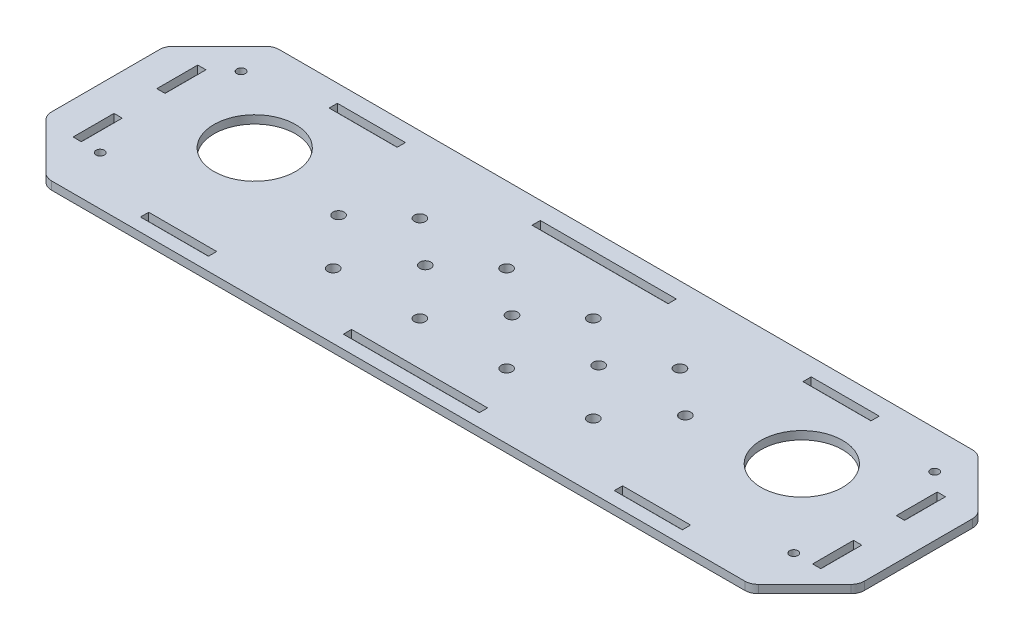
from build123d import *

# Parameters (mm, degrees)
BASE_FLANGE1_START = -3
BASE_FLANGE1_DEPTH = 3
SKETCH6_R          = 1.55
CUT_EXTRUDE1_DEPTH = 10
SKETCH7_R          = 1.55
CUT_EXTRUDE2_DEPTH = 10
SKETCH8_W          = 50.2
SKETCH8_H          = 3.05
SKETCH8_W_2        = 25.1
SKETCH8_W_3        = 3.05
SKETCH8_H_2        = 15.1
CUT_EXTRUDE5_DEPTH = 10
SKETCH12_R         = 15.05
SKETCH12_R_2       = 2.05
CUT_EXTRUDE6_DEPTH = 10


# Read off the part's stored shape, not the designer's step: Base-Flange1
with BuildPart() as part:
    # Base-Flange1 outline → Base-Flange1 (new body)
    with BuildSketch(Plane(origin=(0, 0, 0), x_dir=(1, 0, 0), z_dir=(0, 1, 0)).offset(BASE_FLANGE1_START)):
        with BuildLine():
            Line((-127.928932188, 76), (127.928932188, 76))
            ThreePointArc((127.928932188, 76), (129.84234935, 76.380602337), (131.464466094, 77.464466094))
            Line((131.464466094, 77.464466094), (148.535533906, 94.535533906))
            ThreePointArc((148.535533906, 94.535533906), (149.619397663, 96.15765065), (150, 98.071067812))
            Line((150, 98.071067812), (150, 137.928932188))
            ThreePointArc((150, 137.928932188), (149.619397663, 139.84234935), (148.535533906, 141.464466094))
            Line((148.535533906, 141.464466094), (131.464466094, 158.535533906))
            ThreePointArc((131.464466094, 158.535533906), (129.84234935, 159.619397663), (127.928932188, 160))
            Line((127.928932188, 160), (-127.928932188, 160))
            ThreePointArc((-127.928932188, 160), (-129.84234935, 159.619397663), (-131.464466094, 158.535533906))
            Line((-131.464466094, 158.535533906), (-148.535533906, 141.464466094))
            ThreePointArc((-148.535533906, 141.464466094), (-149.619397663, 139.84234935), (-150, 137.928932188))
            Line((-150, 137.928932188), (-150, 98.071067812))
            ThreePointArc((-150, 98.071067812), (-149.619397663, 96.15765065), (-148.535533906, 94.535533906))
            Line((-148.535533906, 94.535533906), (-131.464466094, 77.464466094))
            ThreePointArc((-131.464466094, 77.464466094), (-129.84234935, 76.380602337), (-127.928932188, 76))
        make_face()
    extrude(amount=BASE_FLANGE1_DEPTH)

    # Sketch6 → Cut-Extrude1 (cut)
    with BuildSketch(Plane(origin=(0, 0, 0), x_dir=(1, 0, 0), z_dir=(0, 1, 0))):
        with Locations(Location((128, 146, 0), (0, 0, 270))):
            Circle(SKETCH6_R)
        with Locations(Location((-128, 146, 0), (0, 0, 90))):
            Circle(SKETCH6_R)
    extrude(amount=-CUT_EXTRUDE1_DEPTH, mode=Mode.SUBTRACT)

    # Sketch7 → Cut-Extrude2 (cut)
    with BuildSketch(Plane(origin=(0, 0, 0), x_dir=(1, 0, 0), z_dir=(0, 1, 0))):
        with Locations(Location((-128, 94, 0), (0, 0, 270))):
            Circle(SKETCH7_R)
        with Locations(Location((128, 94, 0), (0, 0, 90))):
            Circle(SKETCH7_R)
    extrude(amount=-CUT_EXTRUDE2_DEPTH, mode=Mode.SUBTRACT)

    # Sketch8 → Cut-Extrude5 (cut)
    with BuildSketch(Plane(origin=(0, 0, 0), x_dir=(1, 0, 0), z_dir=(0, 1, 0))):
        with Locations((0, 82.375)):
            Rectangle(SKETCH8_W, SKETCH8_H)
        with Locations((87.45, 82.375)):
            Rectangle(SKETCH8_W_2, SKETCH8_H)
        with Locations((136.475, 132.45)):
            Rectangle(SKETCH8_W_3, SKETCH8_H_2)
        with Locations((0, 152.025)):
            Rectangle(SKETCH8_W, SKETCH8_H)
        with Locations((87.45, 152.025)):
            Rectangle(SKETCH8_W_2, SKETCH8_H)
        with Locations((-87.45, 152.025)):
            Rectangle(SKETCH8_W_2, SKETCH8_H)
        with Locations((136.475, 101.55)):
            Rectangle(SKETCH8_W_3, SKETCH8_H_2)
        with Locations((-87.45, 82.375)):
            Rectangle(SKETCH8_W_2, SKETCH8_H)
        with Locations((-136.475, 101.55)):
            Rectangle(SKETCH8_W_3, SKETCH8_H_2)
        with Locations((-136.475, 132.45)):
            Rectangle(SKETCH8_W_3, SKETCH8_H_2)
    extrude(amount=-CUT_EXTRUDE5_DEPTH, mode=Mode.SUBTRACT)

    # Sketch12 → Cut-Extrude6 (cut)
    with BuildSketch(Plane(origin=(0, 0, 0), x_dir=(1, 0, 0), z_dir=(0, 1, 0))):
        with Locations(Location((-100.957746479, 124, 0), (0, 0, 270))):
            Circle(SKETCH12_R)
        with Locations(Location((100.957746479, 124, 0), (0, 0, 90))):
            Circle(SKETCH12_R)
        with Locations(Location((-48, 132, 0), (0, 0, 270))):
            Circle(SKETCH12_R_2)
        with Locations(Location((-48, 100, 0), (0, 0, 270))):
            Circle(SKETCH12_R_2)
        with Locations(Location((-16, 132, 0), (0, 0, 270))):
            Circle(SKETCH12_R_2)
        with Locations(Location((-16, 100, 0), (0, 0, 270))):
            Circle(SKETCH12_R_2)
        with Locations(Location((-32, 118, 0), (0, 0, 270))):
            Circle(SKETCH12_R_2)
        with Locations(Location((0, 118, 0), (0, 0, 270))):
            Circle(SKETCH12_R_2)
        with Locations(Location((-64, 118, 0), (0, 0, 270))):
            Circle(SKETCH12_R_2)
        with Locations(Location((64, 118, 0), (0, 0, 90))):
            Circle(SKETCH12_R_2)
        with Locations(Location((48, 132, 0), (0, 0, 90))):
            Circle(SKETCH12_R_2)
        with Locations(Location((48, 100, 0), (0, 0, 90))):
            Circle(SKETCH12_R_2)
        with Locations(Location((32, 118, 0), (0, 0, 90))):
            Circle(SKETCH12_R_2)
        with Locations(Location((16, 132, 0), (0, 0, 90))):
            Circle(SKETCH12_R_2)
        with Locations(Location((16, 100, 0), (0, 0, 90))):
            Circle(SKETCH12_R_2)
    extrude(amount=-CUT_EXTRUDE6_DEPTH, mode=Mode.SUBTRACT)


solid = part.part
